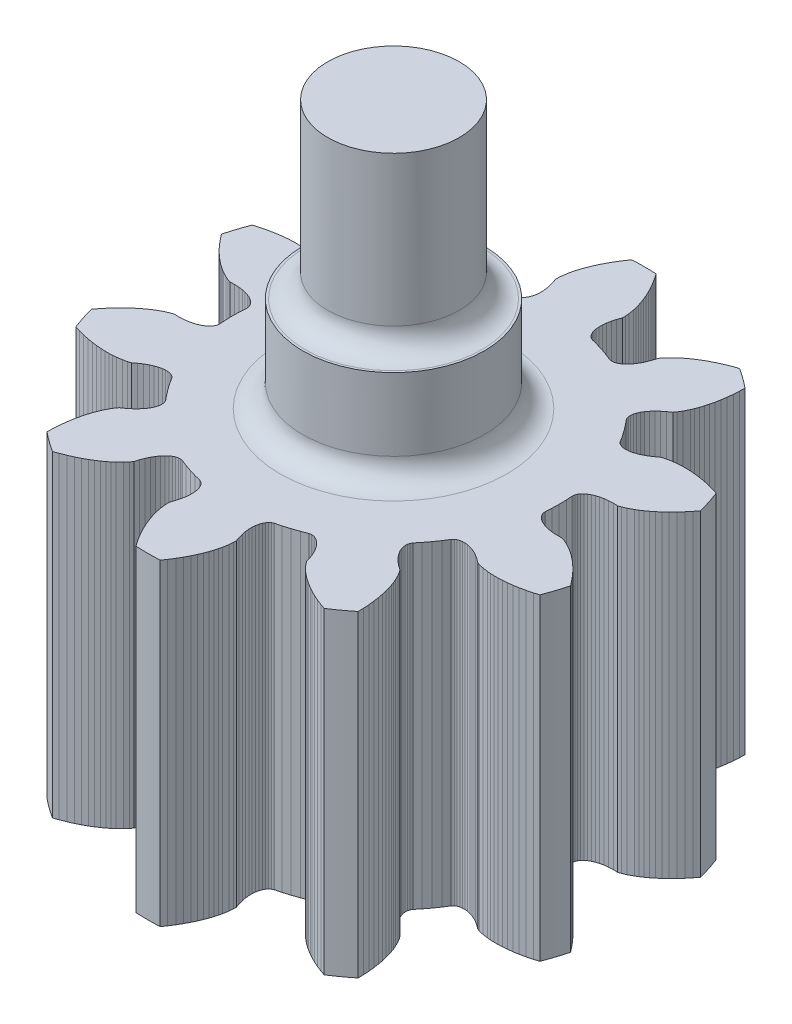
from build123d import *

# Parameters (mm, degrees)
SKETCH1_R           = 2
BOSS_EXTRUDE1_DEPTH = 2.1
SKETCH2_R           = 1.45
BOSS_EXTRUDE3_DEPTH = 3.8
BOSS_EXTRUDE4_DEPTH = 7
FILLET1_R           = 0.5


with BuildPart() as part:
    # Sketch1 → Boss-Extrude1 (new body)
    with BuildSketch(Plane(origin=(0, 0, 0), x_dir=(1, 0, 0), z_dir=(0, 1, 0))):
        Circle(SKETCH1_R)
    extrude(amount=BOSS_EXTRUDE1_DEPTH)

    # Sketch2 → Boss-Extrude3 (add)
    with BuildSketch(Plane(origin=(0, 2.1, 0), x_dir=(1, 0, 0), z_dir=(0, 1, 0))):
        Circle(SKETCH2_R)
    extrude(amount=BOSS_EXTRUDE3_DEPTH)

    # Sketch4 → Boss-Extrude4 (add)
    with BuildSketch(Plane.XZ):
        with BuildLine():
            Line((-3.365581543, -4.018996346), (-3.373679343, -4.150130546))
            Line((-3.373679343, -4.150130546), (-3.376252736, -4.266610639))
            ThreePointArc((-3.376252736, -4.266610639), (-3.163386762, -4.429372163), (-2.942812134, -4.581523634))
            Line((-2.942812134, -4.581523634), (-2.832828234, -4.543081834))
            Line((-2.832828234, -4.543081834), (-2.710614534, -4.494857734))
            Line((-2.710614534, -4.494857734), (-2.595011534, -4.443549834))
            Line((-2.595011534, -4.443549834), (-2.489538234, -4.391316334))
            Line((-2.489538234, -4.391316334), (-2.393256034, -4.338504434))
            Line((-2.393256034, -4.338504434), (-2.305347034, -4.285379634))
            Line((-2.305347034, -4.285379634), (-2.226941634, -4.233414934))
            Line((-2.226941634, -4.233414934), (-2.156092634, -4.182086334))
            Line((-2.156092634, -4.182086334), (-2.093376434, -4.132520734))
            Line((-2.093376434, -4.132520734), (-2.038209034, -4.085023734))
            Line((-2.038209034, -4.085023734), (-1.951084734, -4.000173734))
            Line((-1.951084734, -4.000173734), (-1.889839934, -3.929668734))
            Line((-1.889839934, -3.929668734), (-1.849812534, -3.874434434))
            Line((-1.849812534, -3.874434434), (-1.822351334, -3.781859534))
            Line((-1.822351334, -3.781859534), (-1.788173234, -3.690941334))
            Line((-1.788173234, -3.690941334), (-1.750007934, -3.609530434))
            Line((-1.750007934, -3.609530434), (-1.708581634, -3.537790734))
            Line((-1.708581634, -3.537790734), (-1.664658534, -3.475841734))
            Line((-1.664658534, -3.475841734), (-1.618978234, -3.423758534))
            Line((-1.618978234, -3.423758534), (-1.572277434, -3.381543734))
            Line((-1.572277434, -3.381543734), (-1.525305634, -3.349206134))
            Line((-1.525305634, -3.349206134), (-1.478812834, -3.326659734))
            Line((-1.478812834, -3.326659734), (-1.433533634, -3.313802434))
            Line((-1.433533634, -3.313802434), (-1.390186934, -3.310484934))
            Line((-1.390186934, -3.310484934), (-1.349482734, -3.316497534))
            Line((-1.349482734, -3.316497534), (-1.335052534, -3.321112534))
            Line((-1.335052534, -3.321112534), (-1.208871634, -3.370996034))
            Line((-1.208871634, -3.370996034), (-1.057742534, -3.423833634))
            Line((-1.057742534, -3.423833634), (-0.904419434, -3.469918634))
            Line((-0.904419434, -3.469918634), (-0.773016234, -3.503729234))
            Line((-0.773016234, -3.503729234), (-0.758629334, -3.508477434))
            Line((-0.758629334, -3.508477434), (-0.722164834, -3.527538534))
            Line((-0.722164834, -3.527538534), (-0.689046534, -3.555700934))
            Line((-0.689046534, -3.555700934), (-0.659972234, -3.592717134))
            Line((-0.659972234, -3.592717134), (-0.635611234, -3.638285334))
            Line((-0.635611234, -3.638285334), (-0.616617834, -3.692056434))
            Line((-0.616617834, -3.692056434), (-0.603649334, -3.753658934))
            Line((-0.603649334, -3.753658934), (-0.597306834, -3.822645334))
            Line((-0.597306834, -3.822645334), (-0.598185034, -3.898580434))
            Line((-0.598185034, -3.898580434), (-0.606838034, -3.980968934))
            Line((-0.606838034, -3.980968934), (-0.623813734, -4.069264634))
            Line((-0.623813734, -4.069264634), (-0.649603534, -4.162908434))
            Line((-0.649603534, -4.162908434), (-0.681801034, -4.253944434))
            Line((-0.681801034, -4.253944434), (-0.681884034, -4.322157334))
            Line((-0.681884034, -4.322157334), (-0.673777834, -4.415195934))
            Line((-0.673777834, -4.415195934), (-0.653166434, -4.535051334))
            Line((-0.653166434, -4.535051334), (-0.636453034, -4.605903834))
            Line((-0.636453034, -4.605903834), (-0.614848434, -4.682866834))
            Line((-0.614848434, -4.682866834), (-0.587700634, -4.766036634))
            Line((-0.587700634, -4.766036634), (-0.554813434, -4.854162534))
            Line((-0.554813434, -4.854162534), (-0.514919434, -4.948812934))
            Line((-0.514919434, -4.948812934), (-0.468067634, -5.048132034))
            Line((-0.468067634, -5.048132034), (-0.413440034, -5.152385334))
            Line((-0.413440034, -5.152385334), (-0.350073234, -5.261844034))
            Line((-0.350073234, -5.261844034), (-0.279545834, -5.372693634))
            Line((-0.279545834, -5.372693634), (-0.213162432, -5.468440562))
            ThreePointArc((-0.213162432, -5.468440562), (0.054718567, -5.474997934), (0.322599566, -5.468440561))
            Line((0.322599566, -5.468440561), (0.388982966, -5.372693661))
            Line((0.388982966, -5.372693661), (0.459510466, -5.261844061))
            Line((0.459510466, -5.261844061), (0.522877266, -5.152385361))
            Line((0.522877266, -5.152385361), (0.577504866, -5.048132061))
            Line((0.577504866, -5.048132061), (0.624356666, -4.948812961))
            Line((0.624356666, -4.948812961), (0.664250666, -4.854162561))
            Line((0.664250666, -4.854162561), (0.697137866, -4.766036661))
            Line((0.697137866, -4.766036661), (0.724285666, -4.682866861))
            Line((0.724285666, -4.682866861), (0.745890166, -4.605903861))
            Line((0.745890166, -4.605903861), (0.762603566, -4.535051361))
            Line((0.762603566, -4.535051361), (0.783215066, -4.415195961))
            Line((0.783215066, -4.415195961), (0.791321266, -4.322157361))
            Line((0.791321266, -4.322157361), (0.791238266, -4.253944461))
            Line((0.791238266, -4.253944461), (0.759040666, -4.162908461))
            Line((0.759040666, -4.162908461), (0.733250966, -4.069264661))
            Line((0.733250966, -4.069264661), (0.716275266, -3.980968961))
            Line((0.716275266, -3.980968961), (0.707622266, -3.898580461))
            Line((0.707622266, -3.898580461), (0.706744066, -3.822645361))
            Line((0.706744066, -3.822645361), (0.713086466, -3.753658961))
            Line((0.713086466, -3.753658961), (0.726054966, -3.692056461))
            Line((0.726054966, -3.692056461), (0.745048466, -3.638285361))
            Line((0.745048466, -3.638285361), (0.769409366, -3.592717161))
            Line((0.769409366, -3.592717161), (0.798483766, -3.555700961))
            Line((0.798483766, -3.555700961), (0.831602066, -3.527538561))
            Line((0.831602066, -3.527538561), (0.868066566, -3.508477461))
            Line((0.868066566, -3.508477461), (0.882453366, -3.503729261))
            Line((0.882453366, -3.503729261), (1.013856666, -3.469918661))
            Line((1.013856666, -3.469918661), (1.167179766, -3.423833661))
            Line((1.167179766, -3.423833661), (1.318308866, -3.370996061))
            Line((1.318308866, -3.370996061), (1.444489766, -3.321112561))
            Line((1.444489766, -3.321112561), (1.458919866, -3.316497561))
            Line((1.458919866, -3.316497561), (1.499624066, -3.310484961))
            Line((1.499624066, -3.310484961), (1.542970866, -3.313802461))
            Line((1.542970866, -3.313802461), (1.588250066, -3.326659761))
            Line((1.588250066, -3.326659761), (1.634742766, -3.349206161))
            Line((1.634742766, -3.349206161), (1.681714666, -3.381543761))
            Line((1.681714666, -3.381543761), (1.728415466, -3.423758561))
            Line((1.728415466, -3.423758561), (1.774095766, -3.475841761))
            Line((1.774095766, -3.475841761), (1.818018766, -3.537790761))
            Line((1.818018766, -3.537790761), (1.859445166, -3.609530461))
            Line((1.859445166, -3.609530461), (1.897610466, -3.690941361))
            Line((1.897610466, -3.690941361), (1.931788466, -3.781859561))
            Line((1.931788466, -3.781859561), (1.959249766, -3.874434461))
            Line((1.959249766, -3.874434461), (1.999277166, -3.929668761))
            Line((1.999277166, -3.929668761), (2.060521966, -4.000173761))
            Line((2.060521966, -4.000173761), (2.147646266, -4.085023761))
            Line((2.147646266, -4.085023761), (2.202813666, -4.132520761))
            Line((2.202813666, -4.132520761), (2.265529866, -4.182086361))
            Line((2.265529866, -4.182086361), (2.336378866, -4.233414961))
            Line((2.336378866, -4.233414961), (2.414784266, -4.285379661))
            Line((2.414784266, -4.285379661), (2.502693266, -4.338504461))
            Line((2.502693266, -4.338504461), (2.598975466, -4.391316361))
            Line((2.598975466, -4.391316361), (2.704448766, -4.443549861))
            Line((2.704448766, -4.443549861), (2.820051766, -4.494857761))
            Line((2.820051766, -4.494857761), (2.942265366, -4.543081861))
            Line((2.942265366, -4.543081861), (3.05224926, -4.581523647))
            ThreePointArc((3.05224926, -4.581523647), (3.272823887, -4.429372177), (3.48568986, -4.266610653))
            Line((3.48568986, -4.266610653), (3.48311656, -4.150130553))
            Line((3.48311656, -4.150130553), (3.47501876, -4.018996353))
            Line((3.47501876, -4.018996353), (3.46194536, -3.893196353))
            Line((3.46194536, -3.893196353), (3.44486136, -3.776744253))
            Line((3.44486136, -3.776744253), (3.42438706, -3.668854753))
            Line((3.42438706, -3.668854753), (3.40102776, -3.568831853))
            Line((3.40102776, -3.568831853), (3.37583506, -3.478205853))
            Line((3.37583506, -3.478205853), (3.34891216, -3.394962953))
            Line((3.34891216, -3.394962953), (3.32115286, -3.319999753))
            Line((3.32115286, -3.319999753), (3.29302816, -3.252855053))
            Line((3.29302816, -3.252855053), (3.23925396, -3.143774853))
            Line((3.23925396, -3.143774853), (3.19112526, -3.063740353))
            Line((3.19112526, -3.063740353), (3.15096356, -3.008603753))
            Line((3.15096356, -3.008603753), (3.07140556, -2.953879253))
            Line((3.07140556, -2.953879253), (2.99549886, -2.893278653))
            Line((2.99549886, -2.893278653), (2.92986626, -2.831824053))
            Line((2.92986626, -2.831824053), (2.87443916, -2.770256453))
            Line((2.87443916, -2.770256453), (2.82909506, -2.709339853))
            Line((2.82909506, -2.709339853), (2.79367706, -2.649800653))
            Line((2.79367706, -2.649800653), (2.76795976, -2.592340553))
            Line((2.76795976, -2.592340553), (2.75171996, -2.537674753))
            Line((2.75171996, -2.537674753), (2.74464406, -2.486490253))
            Line((2.74464406, -2.486490253), (2.74640816, -2.439454053))
            Line((2.74640816, -2.439454053), (2.75664786, -2.397203753))
            Line((2.75664786, -2.397203753), (2.77494446, -2.360349753))
            Line((2.77494446, -2.360349753), (2.78379276, -2.348051953))
            Line((2.78379276, -2.348051953), (2.87022686, -2.243461653))
            Line((2.87022686, -2.243461653), (2.96717976, -2.116057053))
            Line((2.96717976, -2.116057053), (3.05838866, -1.984479153))
            Line((3.05838866, -1.984479153), (3.13115036, -1.869955253))
            Line((3.13115036, -1.869955253), (3.14011196, -1.857739853))
            Line((3.14011196, -1.857739853), (3.16950826, -1.828950253))
            Line((3.16950826, -1.828950253), (3.20652646, -1.806155553))
            Line((3.20652646, -1.806155553), (3.25071536, -1.789942853))
            Line((3.25071536, -1.789942853), (3.30158126, -1.780855553))
            Line((3.30158126, -1.780855553), (3.35858986, -1.779407853))
            Line((3.35858986, -1.779407853), (3.42118486, -1.786110353))
            Line((3.42118486, -1.786110353), (3.48875476, -1.801396253))
            Line((3.48875476, -1.801396253), (3.56070196, -1.825696753))
            Line((3.56070196, -1.825696753), (3.63638416, -1.859385653))
            Line((3.63638416, -1.859385653), (3.71511256, -1.902815353))
            Line((3.71511256, -1.902815353), (3.79620356, -1.956280453))
            Line((3.79620356, -1.956280453), (3.87283446, -2.015033753))
            Line((3.87283446, -2.015033753), (3.93768316, -2.036191653))
            Line((3.93768316, -2.036191653), (4.02867306, -2.057232653))
            Line((4.02867306, -2.057232653), (4.14903166, -2.074667453))
            Line((4.14903166, -2.074667453), (4.22158106, -2.080666653))
            Line((4.22158106, -2.080666653), (4.30145336, -2.083902453))
            Line((4.30145336, -2.083902453), (4.38894166, -2.083784153))
            Line((4.38894166, -2.083784153), (4.48291706, -2.079738953))
            Line((4.48291706, -2.079738953), (4.58526296, -2.071046153))
            Line((4.58526296, -2.071046153), (4.69419896, -2.057178653))
            Line((4.69419896, -2.057178653), (4.81023066, -2.037440853))
            Line((4.81023066, -2.037440853), (4.93391346, -2.011000053))
            Line((4.93391346, -2.011000053), (5.06113186, -1.978178753))
            Line((5.06113186, -1.978178753), (5.172706205, -1.944631873))
            ThreePointArc((5.172706205, -1.944631873), (5.261722436, -1.691888261), (5.338265806, -1.435091968))
            Line((5.338265806, -1.435091968), (5.267718606, -1.342370168))
            Line((5.267718606, -1.342370168), (5.184088606, -1.241040168))
            Line((5.184088606, -1.241040168), (5.099568606, -1.146950168))
            Line((5.099568606, -1.146950168), (5.017298606, -1.062780168))
            Line((5.017298606, -1.062780168), (4.937318606, -0.987530168))
            Line((4.937318606, -0.987530168), (4.859628606, -0.920340168))
            Line((4.859628606, -0.920340168), (4.785978606, -0.861830168))
            Line((4.785978606, -0.861830168), (4.715268606, -0.810310168))
            Line((4.715268606, -0.810310168), (4.648748606, -0.765980168))
            Line((4.648748606, -0.765980168), (4.586528606, -0.728190168))
            Line((4.586528606, -0.728190168), (4.478908606, -0.671550168))
            Line((4.478908606, -0.671550168), (4.392928606, -0.635090168))
            Line((4.392928606, -0.635090168), (4.328028606, -0.614090168))
            Line((4.328028606, -0.614090168), (4.231498606, -0.616580168))
            Line((4.231498606, -0.616580168), (4.134468606, -0.612170168))
            Line((4.134468606, -0.612170168), (4.045248606, -0.601030168))
            Line((4.045248606, -0.601030168), (3.964218606, -0.583800168))
            Line((3.964218606, -0.583800168), (3.891728606, -0.561170168))
            Line((3.891728606, -0.561170168), (3.828078606, -0.533820168))
            Line((3.828078606, -0.533820168), (3.773498606, -0.502450168))
            Line((3.773498606, -0.502450168), (3.728228606, -0.467770168))
            Line((3.728228606, -0.467770168), (3.692418606, -0.430520168))
            Line((3.692418606, -0.430520168), (3.666198606, -0.391430168))
            Line((3.666198606, -0.391430168), (3.649648606, -0.351230168))
            Line((3.649648606, -0.351230168), (3.642788606, -0.310660168))
            Line((3.642788606, -0.310660168), (3.642718606, -0.295510168))
            Line((3.642718606, -0.295510168), (3.651168606, -0.160090168))
            Line((3.651168606, -0.160090168), (3.654718606, -3.0168e-05))
            Line((3.654718606, -3.0168e-05), (3.651168606, 0.160029832))
            Line((3.651168606, 0.160029832), (3.642718606, 0.295449832))
            Line((3.642718606, 0.295449832), (3.642788606, 0.310599832))
            Line((3.642788606, 0.310599832), (3.649648606, 0.351169832))
            Line((3.649648606, 0.351169832), (3.666198606, 0.391369832))
            Line((3.666198606, 0.391369832), (3.692418606, 0.430459832))
            Line((3.692418606, 0.430459832), (3.728228606, 0.467709832))
            Line((3.728228606, 0.467709832), (3.773498606, 0.502389832))
            Line((3.773498606, 0.502389832), (3.828078606, 0.533759832))
            Line((3.828078606, 0.533759832), (3.891728606, 0.561109832))
            Line((3.891728606, 0.561109832), (3.964218606, 0.583739832))
            Line((3.964218606, 0.583739832), (4.045248606, 0.600969832))
            Line((4.045248606, 0.600969832), (4.134468606, 0.612109832))
            Line((4.134468606, 0.612109832), (4.231498606, 0.616519832))
            Line((4.231498606, 0.616519832), (4.328028606, 0.614029832))
            Line((4.328028606, 0.614029832), (4.392928606, 0.635029832))
            Line((4.392928606, 0.635029832), (4.478908606, 0.671489832))
            Line((4.478908606, 0.671489832), (4.586528606, 0.728129832))
            Line((4.586528606, 0.728129832), (4.648748606, 0.765919832))
            Line((4.648748606, 0.765919832), (4.715268606, 0.810249832))
            Line((4.715268606, 0.810249832), (4.785978606, 0.861769832))
            Line((4.785978606, 0.861769832), (4.859628606, 0.920279832))
            Line((4.859628606, 0.920279832), (4.937318606, 0.987469832))
            Line((4.937318606, 0.987469832), (5.017298606, 1.062719832))
            Line((5.017298606, 1.062719832), (5.099568606, 1.146889832))
            Line((5.099568606, 1.146889832), (5.184088606, 1.240979832))
            Line((5.184088606, 1.240979832), (5.267718606, 1.342309832))
            Line((5.267718606, 1.342309832), (5.338265851, 1.435031648))
            ThreePointArc((5.338265851, 1.435031648), (5.261722483, 1.691827937), (5.172706252, 1.944571547))
            Line((5.172706252, 1.944571547), (5.061131952, 1.978118447))
            Line((5.061131952, 1.978118447), (4.933913552, 2.010939747))
            Line((4.933913552, 2.010939747), (4.810230752, 2.037380547))
            Line((4.810230752, 2.037380547), (4.694199052, 2.057118347))
            Line((4.694199052, 2.057118347), (4.585263052, 2.070985847))
            Line((4.585263052, 2.070985847), (4.482917152, 2.079678647))
            Line((4.482917152, 2.079678647), (4.388941752, 2.083723847))
            Line((4.388941752, 2.083723847), (4.301453452, 2.083842147))
            Line((4.301453452, 2.083842147), (4.221581152, 2.080606347))
            Line((4.221581152, 2.080606347), (4.149031752, 2.074607147))
            Line((4.149031752, 2.074607147), (4.028673152, 2.057172347))
            Line((4.028673152, 2.057172347), (3.937683252, 2.036131347))
            Line((3.937683252, 2.036131347), (3.872834552, 2.014973447))
            Line((3.872834552, 2.014973447), (3.796203652, 1.956220147))
            Line((3.796203652, 1.956220147), (3.715112652, 1.902755047))
            Line((3.715112652, 1.902755047), (3.636384252, 1.859325347))
            Line((3.636384252, 1.859325347), (3.560702052, 1.825636447))
            Line((3.560702052, 1.825636447), (3.488754852, 1.801335947))
            Line((3.488754852, 1.801335947), (3.421184952, 1.786050047))
            Line((3.421184952, 1.786050047), (3.358589952, 1.779347547))
            Line((3.358589952, 1.779347547), (3.301581352, 1.780795247))
            Line((3.301581352, 1.780795247), (3.250715452, 1.789882547))
            Line((3.250715452, 1.789882547), (3.206526552, 1.806095247))
            Line((3.206526552, 1.806095247), (3.169508352, 1.828889947))
            Line((3.169508352, 1.828889947), (3.140112052, 1.857679547))
            Line((3.140112052, 1.857679547), (3.131150452, 1.869894947))
            Line((3.131150452, 1.869894947), (3.058388752, 1.984418847))
            Line((3.058388752, 1.984418847), (2.967179852, 2.115996747))
            Line((2.967179852, 2.115996747), (2.870226952, 2.243401347))
            Line((2.870226952, 2.243401347), (2.783792852, 2.347991647))
            Line((2.783792852, 2.347991647), (2.774944552, 2.360289447))
            Line((2.774944552, 2.360289447), (2.756647952, 2.397143447))
            Line((2.756647952, 2.397143447), (2.746408252, 2.439393747))
            Line((2.746408252, 2.439393747), (2.744644152, 2.486429947))
            Line((2.744644152, 2.486429947), (2.751720052, 2.537614447))
            Line((2.751720052, 2.537614447), (2.767959852, 2.592280247))
            Line((2.767959852, 2.592280247), (2.793677152, 2.649740347))
            Line((2.793677152, 2.649740347), (2.829095152, 2.709279547))
            Line((2.829095152, 2.709279547), (2.874439252, 2.770196147))
            Line((2.874439252, 2.770196147), (2.929866352, 2.831763747))
            Line((2.929866352, 2.831763747), (2.995498952, 2.893218347))
            Line((2.995498952, 2.893218347), (3.071405652, 2.953818947))
            Line((3.071405652, 2.953818947), (3.150963652, 3.008543447))
            Line((3.150963652, 3.008543447), (3.191125352, 3.063680047))
            Line((3.191125352, 3.063680047), (3.239254052, 3.143714547))
            Line((3.239254052, 3.143714547), (3.293028252, 3.252794747))
            Line((3.293028252, 3.252794747), (3.321152952, 3.319939447))
            Line((3.321152952, 3.319939447), (3.348912252, 3.394902647))
            Line((3.348912252, 3.394902647), (3.375835152, 3.478145547))
            Line((3.375835152, 3.478145547), (3.401027852, 3.568771547))
            Line((3.401027852, 3.568771547), (3.424387152, 3.668794447))
            Line((3.424387152, 3.668794447), (3.444861452, 3.776683947))
            Line((3.444861452, 3.776683947), (3.461945452, 3.893136047))
            Line((3.461945452, 3.893136047), (3.475018852, 4.018936047))
            Line((3.475018852, 4.018936047), (3.483116652, 4.150070247))
            Line((3.483116652, 4.150070247), (3.485690045, 4.266550339))
            ThreePointArc((3.485690045, 4.266550339), (3.272824071, 4.429311864), (3.052249443, 4.581463335))
            Line((3.052249443, 4.581463335), (2.942265443, 4.543021535))
            Line((2.942265443, 4.543021535), (2.820051843, 4.494797435))
            Line((2.820051843, 4.494797435), (2.704448843, 4.443489535))
            Line((2.704448843, 4.443489535), (2.598975543, 4.391256035))
            Line((2.598975543, 4.391256035), (2.502693343, 4.338444135))
            Line((2.502693343, 4.338444135), (2.414784343, 4.285319335))
            Line((2.414784343, 4.285319335), (2.336378943, 4.233354635))
            Line((2.336378943, 4.233354635), (2.265529943, 4.182026035))
            Line((2.265529943, 4.182026035), (2.202813743, 4.132460435))
            Line((2.202813743, 4.132460435), (2.147646343, 4.084963435))
            Line((2.147646343, 4.084963435), (2.060522043, 4.000113435))
            Line((2.060522043, 4.000113435), (1.999277243, 3.929608435))
            Line((1.999277243, 3.929608435), (1.959249843, 3.874374135))
            Line((1.959249843, 3.874374135), (1.931788543, 3.781799235))
            Line((1.931788543, 3.781799235), (1.897610543, 3.690881035))
            Line((1.897610543, 3.690881035), (1.859445243, 3.609470135))
            Line((1.859445243, 3.609470135), (1.818018843, 3.537730435))
            Line((1.818018843, 3.537730435), (1.774095843, 3.475781435))
            Line((1.774095843, 3.475781435), (1.728415543, 3.423698235))
            Line((1.728415543, 3.423698235), (1.681714743, 3.381483435))
            Line((1.681714743, 3.381483435), (1.634742843, 3.349145835))
            Line((1.634742843, 3.349145835), (1.588250143, 3.326599435))
            Line((1.588250143, 3.326599435), (1.542970943, 3.313742135))
            Line((1.542970943, 3.313742135), (1.499624143, 3.310424635))
            Line((1.499624143, 3.310424635), (1.458919943, 3.316437235))
            Line((1.458919943, 3.316437235), (1.444489843, 3.321052235))
            Line((1.444489843, 3.321052235), (1.318308943, 3.370935735))
            Line((1.318308943, 3.370935735), (1.167179843, 3.423773335))
            Line((1.167179843, 3.423773335), (1.013856743, 3.469858335))
            Line((1.013856743, 3.469858335), (0.882453443, 3.503668935))
            Line((0.882453443, 3.503668935), (0.868066643, 3.508417135))
            Line((0.868066643, 3.508417135), (0.831602143, 3.527478235))
            Line((0.831602143, 3.527478235), (0.798483843, 3.555640635))
            Line((0.798483843, 3.555640635), (0.769409443, 3.592656835))
            Line((0.769409443, 3.592656835), (0.745048543, 3.638225035))
            Line((0.745048543, 3.638225035), (0.726055043, 3.691996135))
            Line((0.726055043, 3.691996135), (0.713086543, 3.753598635))
            Line((0.713086543, 3.753598635), (0.706744143, 3.822585035))
            Line((0.706744143, 3.822585035), (0.707622343, 3.898520135))
            Line((0.707622343, 3.898520135), (0.716275343, 3.980908635))
            Line((0.716275343, 3.980908635), (0.733251043, 4.069204335))
            Line((0.733251043, 4.069204335), (0.759040743, 4.162848135))
            Line((0.759040743, 4.162848135), (0.791238343, 4.253884135))
            Line((0.791238343, 4.253884135), (0.791321343, 4.322097035))
            Line((0.791321343, 4.322097035), (0.783215143, 4.415135635))
            Line((0.783215143, 4.415135635), (0.762603643, 4.534991035))
            Line((0.762603643, 4.534991035), (0.745890243, 4.605843535))
            Line((0.745890243, 4.605843535), (0.724285743, 4.682806535))
            Line((0.724285743, 4.682806535), (0.697137943, 4.765976335))
            Line((0.697137943, 4.765976335), (0.664250743, 4.854102235))
            Line((0.664250743, 4.854102235), (0.624356743, 4.948752635))
            Line((0.624356743, 4.948752635), (0.577504943, 5.048071735))
            Line((0.577504943, 5.048071735), (0.522877343, 5.152325035))
            Line((0.522877343, 5.152325035), (0.459510543, 5.261783735))
            Line((0.459510543, 5.261783735), (0.388983043, 5.372633335))
            Line((0.388983043, 5.372633335), (0.322599641, 5.468380262))
            ThreePointArc((0.322599641, 5.468380262), (0.054718642, 5.474937635), (-0.213162357, 5.468380262))
            Line((-0.213162357, 5.468380262), (-0.279545757, 5.372633362))
            Line((-0.279545757, 5.372633362), (-0.350073157, 5.261783762))
            Line((-0.350073157, 5.261783762), (-0.413439957, 5.152325062))
            Line((-0.413439957, 5.152325062), (-0.468067557, 5.048071762))
            Line((-0.468067557, 5.048071762), (-0.514919357, 4.948752662))
            Line((-0.514919357, 4.948752662), (-0.554813357, 4.854102262))
            Line((-0.554813357, 4.854102262), (-0.587700557, 4.765976362))
            Line((-0.587700557, 4.765976362), (-0.614848357, 4.682806562))
            Line((-0.614848357, 4.682806562), (-0.636452957, 4.605843562))
            Line((-0.636452957, 4.605843562), (-0.653166357, 4.534991062))
            Line((-0.653166357, 4.534991062), (-0.673777757, 4.415135662))
            Line((-0.673777757, 4.415135662), (-0.681883957, 4.322097062))
            Line((-0.681883957, 4.322097062), (-0.681800957, 4.253884162))
            Line((-0.681800957, 4.253884162), (-0.649603457, 4.162848162))
            Line((-0.649603457, 4.162848162), (-0.623813657, 4.069204362))
            Line((-0.623813657, 4.069204362), (-0.606837957, 3.980908662))
            Line((-0.606837957, 3.980908662), (-0.598184957, 3.898520162))
            Line((-0.598184957, 3.898520162), (-0.597306757, 3.822585062))
            Line((-0.597306757, 3.822585062), (-0.603649257, 3.753598662))
            Line((-0.603649257, 3.753598662), (-0.616617757, 3.691996162))
            Line((-0.616617757, 3.691996162), (-0.635611157, 3.638225062))
            Line((-0.635611157, 3.638225062), (-0.659972157, 3.592656862))
            Line((-0.659972157, 3.592656862), (-0.689046457, 3.555640662))
            Line((-0.689046457, 3.555640662), (-0.722164757, 3.527478262))
            Line((-0.722164757, 3.527478262), (-0.758629257, 3.508417162))
            Line((-0.758629257, 3.508417162), (-0.773016157, 3.503668962))
            Line((-0.773016157, 3.503668962), (-0.904419357, 3.469858362))
            Line((-0.904419357, 3.469858362), (-1.057742457, 3.423773362))
            Line((-1.057742457, 3.423773362), (-1.208871557, 3.370935762))
            Line((-1.208871557, 3.370935762), (-1.335052457, 3.321052262))
            Line((-1.335052457, 3.321052262), (-1.349482657, 3.316437262))
            Line((-1.349482657, 3.316437262), (-1.390186857, 3.310424662))
            Line((-1.390186857, 3.310424662), (-1.433533557, 3.313742162))
            Line((-1.433533557, 3.313742162), (-1.478812757, 3.326599462))
            Line((-1.478812757, 3.326599462), (-1.525305557, 3.349145862))
            Line((-1.525305557, 3.349145862), (-1.572277357, 3.381483462))
            Line((-1.572277357, 3.381483462), (-1.618978157, 3.423698262))
            Line((-1.618978157, 3.423698262), (-1.664658457, 3.475781462))
            Line((-1.664658457, 3.475781462), (-1.708581557, 3.537730462))
            Line((-1.708581557, 3.537730462), (-1.750007857, 3.609470162))
            Line((-1.750007857, 3.609470162), (-1.788173157, 3.690881062))
            Line((-1.788173157, 3.690881062), (-1.822351257, 3.781799262))
            Line((-1.822351257, 3.781799262), (-1.849812457, 3.874374162))
            Line((-1.849812457, 3.874374162), (-1.889839857, 3.929608462))
            Line((-1.889839857, 3.929608462), (-1.951084657, 4.000113462))
            Line((-1.951084657, 4.000113462), (-2.038208957, 4.084963462))
            Line((-2.038208957, 4.084963462), (-2.093376357, 4.132460462))
            Line((-2.093376357, 4.132460462), (-2.156092557, 4.182026062))
            Line((-2.156092557, 4.182026062), (-2.226941557, 4.233354662))
            Line((-2.226941557, 4.233354662), (-2.305346957, 4.285319362))
            Line((-2.305346957, 4.285319362), (-2.393255957, 4.338444162))
            Line((-2.393255957, 4.338444162), (-2.489538157, 4.391256062))
            Line((-2.489538157, 4.391256062), (-2.595011457, 4.443489562))
            Line((-2.595011457, 4.443489562), (-2.710614457, 4.494797462))
            Line((-2.710614457, 4.494797462), (-2.832828157, 4.543021562))
            Line((-2.832828157, 4.543021562), (-2.942811951, 4.581463348))
            ThreePointArc((-2.942811951, 4.581463348), (-3.163386578, 4.429311877), (-3.376252551, 4.266550354))
            Line((-3.376252551, 4.266550354), (-3.373679251, 4.150070254))
            Line((-3.373679251, 4.150070254), (-3.365581451, 4.018936054))
            Line((-3.365581451, 4.018936054), (-3.352508051, 3.893136054))
            Line((-3.352508051, 3.893136054), (-3.335424051, 3.776683954))
            Line((-3.335424051, 3.776683954), (-3.314949751, 3.668794454))
            Line((-3.314949751, 3.668794454), (-3.291590551, 3.568771554))
            Line((-3.291590551, 3.568771554), (-3.266397751, 3.478145554))
            Line((-3.266397751, 3.478145554), (-3.239474851, 3.394902654))
            Line((-3.239474851, 3.394902654), (-3.211715551, 3.319939454))
            Line((-3.211715551, 3.319939454), (-3.183590951, 3.252794754))
            Line((-3.183590951, 3.252794754), (-3.129816651, 3.143714554))
            Line((-3.129816651, 3.143714554), (-3.081688051, 3.063680054))
            Line((-3.081688051, 3.063680054), (-3.041526351, 3.008543454))
            Line((-3.041526351, 3.008543454), (-2.961968351, 2.953818954))
            Line((-2.961968351, 2.953818954), (-2.886061551, 2.893218354))
            Line((-2.886061551, 2.893218354), (-2.820428951, 2.831763754))
            Line((-2.820428951, 2.831763754), (-2.765001851, 2.770196154))
            Line((-2.765001851, 2.770196154), (-2.719657751, 2.709279554))
            Line((-2.719657751, 2.709279554), (-2.684239751, 2.649740354))
            Line((-2.684239751, 2.649740354), (-2.658522451, 2.592280254))
            Line((-2.658522451, 2.592280254), (-2.642282651, 2.537614454))
            Line((-2.642282651, 2.537614454), (-2.635206751, 2.486429954))
            Line((-2.635206751, 2.486429954), (-2.636970851, 2.439393754))
            Line((-2.636970851, 2.439393754), (-2.647210551, 2.397143454))
            Line((-2.647210551, 2.397143454), (-2.665507151, 2.360289454))
            Line((-2.665507151, 2.360289454), (-2.674355551, 2.347991654))
            Line((-2.674355551, 2.347991654), (-2.760789551, 2.243401354))
            Line((-2.760789551, 2.243401354), (-2.857742451, 2.115996754))
            Line((-2.857742451, 2.115996754), (-2.948951351, 1.984418854))
            Line((-2.948951351, 1.984418854), (-3.021713051, 1.869894954))
            Line((-3.021713051, 1.869894954), (-3.030674651, 1.857679554))
            Line((-3.030674651, 1.857679554), (-3.060070951, 1.828889954))
            Line((-3.060070951, 1.828889954), (-3.097089151, 1.806095254))
            Line((-3.097089151, 1.806095254), (-3.141278151, 1.789882554))
            Line((-3.141278151, 1.789882554), (-3.192144051, 1.780795254))
            Line((-3.192144051, 1.780795254), (-3.249152551, 1.779347554))
            Line((-3.249152551, 1.779347554), (-3.311747551, 1.786050054))
            Line((-3.311747551, 1.786050054), (-3.379317451, 1.801335954))
            Line((-3.379317451, 1.801335954), (-3.451264651, 1.825636454))
            Line((-3.451264651, 1.825636454), (-3.526946851, 1.859325354))
            Line((-3.526946851, 1.859325354), (-3.605675251, 1.902755054))
            Line((-3.605675251, 1.902755054), (-3.686766351, 1.956220154))
            Line((-3.686766351, 1.956220154), (-3.763397151, 2.014973454))
            Line((-3.763397151, 2.014973454), (-3.828245851, 2.036131354))
            Line((-3.828245851, 2.036131354), (-3.919235751, 2.057172354))
            Line((-3.919235751, 2.057172354), (-4.039594351, 2.074607154))
            Line((-4.039594351, 2.074607154), (-4.112143751, 2.080606354))
            Line((-4.112143751, 2.080606354), (-4.192016151, 2.083842154))
            Line((-4.192016151, 2.083842154), (-4.279504351, 2.083723854))
            Line((-4.279504351, 2.083723854), (-4.373479851, 2.079678654))
            Line((-4.373479851, 2.079678654), (-4.475825651, 2.070985854))
            Line((-4.475825651, 2.070985854), (-4.584761651, 2.057118354))
            Line((-4.584761651, 2.057118354), (-4.700793351, 2.037380554))
            Line((-4.700793351, 2.037380554), (-4.824476151, 2.010939754))
            Line((-4.824476151, 2.010939754), (-4.951694551, 1.978118454))
            Line((-4.951694551, 1.978118454), (-5.063268895, 1.944571574))
            ThreePointArc((-5.063268895, 1.944571574), (-5.152285127, 1.691827961), (-5.228828497, 1.435031669))
            Line((-5.228828497, 1.435031669), (-5.158281397, 1.342309869))
            Line((-5.158281397, 1.342309869), (-5.074651397, 1.240979869))
            Line((-5.074651397, 1.240979869), (-4.990131397, 1.146889869))
            Line((-4.990131397, 1.146889869), (-4.907861397, 1.062719869))
            Line((-4.907861397, 1.062719869), (-4.827881397, 0.987469869))
            Line((-4.827881397, 0.987469869), (-4.750191397, 0.920279869))
            Line((-4.750191397, 0.920279869), (-4.676541397, 0.861769869))
            Line((-4.676541397, 0.861769869), (-4.605831397, 0.810249869))
            Line((-4.605831397, 0.810249869), (-4.539311397, 0.765919869))
            Line((-4.539311397, 0.765919869), (-4.477091397, 0.728129869))
            Line((-4.477091397, 0.728129869), (-4.369471397, 0.671489869))
            Line((-4.369471397, 0.671489869), (-4.283491397, 0.635029869))
            Line((-4.283491397, 0.635029869), (-4.218591397, 0.614029869))
            Line((-4.218591397, 0.614029869), (-4.122061397, 0.616519869))
            Line((-4.122061397, 0.616519869), (-4.025031397, 0.612109869))
            Line((-4.025031397, 0.612109869), (-3.935811397, 0.600969869))
            Line((-3.935811397, 0.600969869), (-3.854781397, 0.583739869))
            Line((-3.854781397, 0.583739869), (-3.782291397, 0.561109869))
            Line((-3.782291397, 0.561109869), (-3.718641397, 0.533759869))
            Line((-3.718641397, 0.533759869), (-3.664061397, 0.502389869))
            Line((-3.664061397, 0.502389869), (-3.618791397, 0.467709869))
            Line((-3.618791397, 0.467709869), (-3.582981397, 0.430459869))
            Line((-3.582981397, 0.430459869), (-3.556761397, 0.391369869))
            Line((-3.556761397, 0.391369869), (-3.540211397, 0.351169869))
            Line((-3.540211397, 0.351169869), (-3.533351397, 0.310599869))
            Line((-3.533351397, 0.310599869), (-3.533281397, 0.295449869))
            Line((-3.533281397, 0.295449869), (-3.541731397, 0.160029869))
            Line((-3.541731397, 0.160029869), (-3.545281397, -3.0131e-05))
            Line((-3.545281397, -3.0131e-05), (-3.541731397, -0.160090131))
            Line((-3.541731397, -0.160090131), (-3.533281397, -0.295510131))
            Line((-3.533281397, -0.295510131), (-3.533351397, -0.310660131))
            Line((-3.533351397, -0.310660131), (-3.540211397, -0.351230131))
            Line((-3.540211397, -0.351230131), (-3.556761397, -0.391430131))
            Line((-3.556761397, -0.391430131), (-3.582981397, -0.430520131))
            Line((-3.582981397, -0.430520131), (-3.618791397, -0.467770131))
            Line((-3.618791397, -0.467770131), (-3.664061397, -0.502450131))
            Line((-3.664061397, -0.502450131), (-3.718641397, -0.533820131))
            Line((-3.718641397, -0.533820131), (-3.782291397, -0.561170131))
            Line((-3.782291397, -0.561170131), (-3.854781397, -0.583800131))
            Line((-3.854781397, -0.583800131), (-3.935811397, -0.601030131))
            Line((-3.935811397, -0.601030131), (-4.025031397, -0.612170131))
            Line((-4.025031397, -0.612170131), (-4.122061397, -0.616580131))
            Line((-4.122061397, -0.616580131), (-4.218591397, -0.614090131))
            Line((-4.218591397, -0.614090131), (-4.283491397, -0.635090131))
            Line((-4.283491397, -0.635090131), (-4.369471397, -0.671550131))
            Line((-4.369471397, -0.671550131), (-4.477091397, -0.728190131))
            Line((-4.477091397, -0.728190131), (-4.539311397, -0.765980131))
            Line((-4.539311397, -0.765980131), (-4.605831397, -0.810310131))
            Line((-4.605831397, -0.810310131), (-4.676541397, -0.861830131))
            Line((-4.676541397, -0.861830131), (-4.750191397, -0.920340131))
            Line((-4.750191397, -0.920340131), (-4.827881397, -0.987530131))
            Line((-4.827881397, -0.987530131), (-4.907861397, -1.062780131))
            Line((-4.907861397, -1.062780131), (-4.990131397, -1.146950131))
            Line((-4.990131397, -1.146950131), (-5.074651397, -1.241040131))
            Line((-5.074651397, -1.241040131), (-5.158281397, -1.342370131))
            Line((-5.158281397, -1.342370131), (-5.228828642, -1.435091947))
            ThreePointArc((-5.228828642, -1.435091947), (-5.152285273, -1.691888237), (-5.063269043, -1.944631846))
            Line((-5.063269043, -1.944631846), (-4.951694643, -1.978178746))
            Line((-4.951694643, -1.978178746), (-4.824476243, -2.011000046))
            Line((-4.824476243, -2.011000046), (-4.700793443, -2.037440846))
            Line((-4.700793443, -2.037440846), (-4.584761743, -2.057178646))
            Line((-4.584761743, -2.057178646), (-4.475825743, -2.071046146))
            Line((-4.475825743, -2.071046146), (-4.373479943, -2.079738946))
            Line((-4.373479943, -2.079738946), (-4.279504443, -2.083784146))
            Line((-4.279504443, -2.083784146), (-4.192016243, -2.083902446))
            Line((-4.192016243, -2.083902446), (-4.112143843, -2.080666646))
            Line((-4.112143843, -2.080666646), (-4.039594443, -2.074667446))
            Line((-4.039594443, -2.074667446), (-3.919235843, -2.057232646))
            Line((-3.919235843, -2.057232646), (-3.828245943, -2.036191646))
            Line((-3.828245943, -2.036191646), (-3.763397243, -2.015033746))
            Line((-3.763397243, -2.015033746), (-3.686766443, -1.956280446))
            Line((-3.686766443, -1.956280446), (-3.605675343, -1.902815346))
            Line((-3.605675343, -1.902815346), (-3.526946943, -1.859385646))
            Line((-3.526946943, -1.859385646), (-3.451264743, -1.825696746))
            Line((-3.451264743, -1.825696746), (-3.379317543, -1.801396246))
            Line((-3.379317543, -1.801396246), (-3.311747643, -1.786110346))
            Line((-3.311747643, -1.786110346), (-3.249152643, -1.779407846))
            Line((-3.249152643, -1.779407846), (-3.192144143, -1.780855546))
            Line((-3.192144143, -1.780855546), (-3.141278243, -1.789942846))
            Line((-3.141278243, -1.789942846), (-3.097089243, -1.806155546))
            Line((-3.097089243, -1.806155546), (-3.060071043, -1.828950246))
            Line((-3.060071043, -1.828950246), (-3.030674743, -1.857739846))
            Line((-3.030674743, -1.857739846), (-3.021713143, -1.869955246))
            Line((-3.021713143, -1.869955246), (-2.948951443, -1.984479146))
            Line((-2.948951443, -1.984479146), (-2.857742543, -2.116057046))
            Line((-2.857742543, -2.116057046), (-2.760789643, -2.243461646))
            Line((-2.760789643, -2.243461646), (-2.674355643, -2.348051946))
            Line((-2.674355643, -2.348051946), (-2.665507243, -2.360349746))
            Line((-2.665507243, -2.360349746), (-2.647210643, -2.397203746))
            Line((-2.647210643, -2.397203746), (-2.636970943, -2.439454046))
            Line((-2.636970943, -2.439454046), (-2.635206843, -2.486490246))
            Line((-2.635206843, -2.486490246), (-2.642282743, -2.537674746))
            Line((-2.642282743, -2.537674746), (-2.658522543, -2.592340546))
            Line((-2.658522543, -2.592340546), (-2.684239843, -2.649800646))
            Line((-2.684239843, -2.649800646), (-2.719657843, -2.709339846))
            Line((-2.719657843, -2.709339846), (-2.765001943, -2.770256446))
            Line((-2.765001943, -2.770256446), (-2.820429043, -2.831824046))
            Line((-2.820429043, -2.831824046), (-2.886061643, -2.893278646))
            Line((-2.886061643, -2.893278646), (-2.961968443, -2.953879246))
            Line((-2.961968443, -2.953879246), (-3.041526443, -3.008603746))
            Line((-3.041526443, -3.008603746), (-3.081688143, -3.063740346))
            Line((-3.081688143, -3.063740346), (-3.129816743, -3.143774846))
            Line((-3.129816743, -3.143774846), (-3.183591043, -3.252855046))
            Line((-3.183591043, -3.252855046), (-3.211715643, -3.319999746))
            Line((-3.211715643, -3.319999746), (-3.239474943, -3.394962946))
            Line((-3.239474943, -3.394962946), (-3.266397843, -3.478205846))
            Line((-3.266397843, -3.478205846), (-3.291590643, -3.568831846))
            Line((-3.291590643, -3.568831846), (-3.314949843, -3.668854746))
            Line((-3.314949843, -3.668854746), (-3.335424143, -3.776744246))
            Line((-3.335424143, -3.776744246), (-3.352508143, -3.893196346))
            Line((-3.352508143, -3.893196346), (-3.365581543, -4.018996346))
        make_face()
    extrude(amount=BOSS_EXTRUDE4_DEPTH)

    # Fillet1
    fillet1_edges = [part.edges().sort_by_distance(p)[0] for p in [
        (-1.45, 2.1, 0),
        (-2, 0, 0),
    ]]
    fillet(fillet1_edges, radius=FILLET1_R)


solid = part.part
